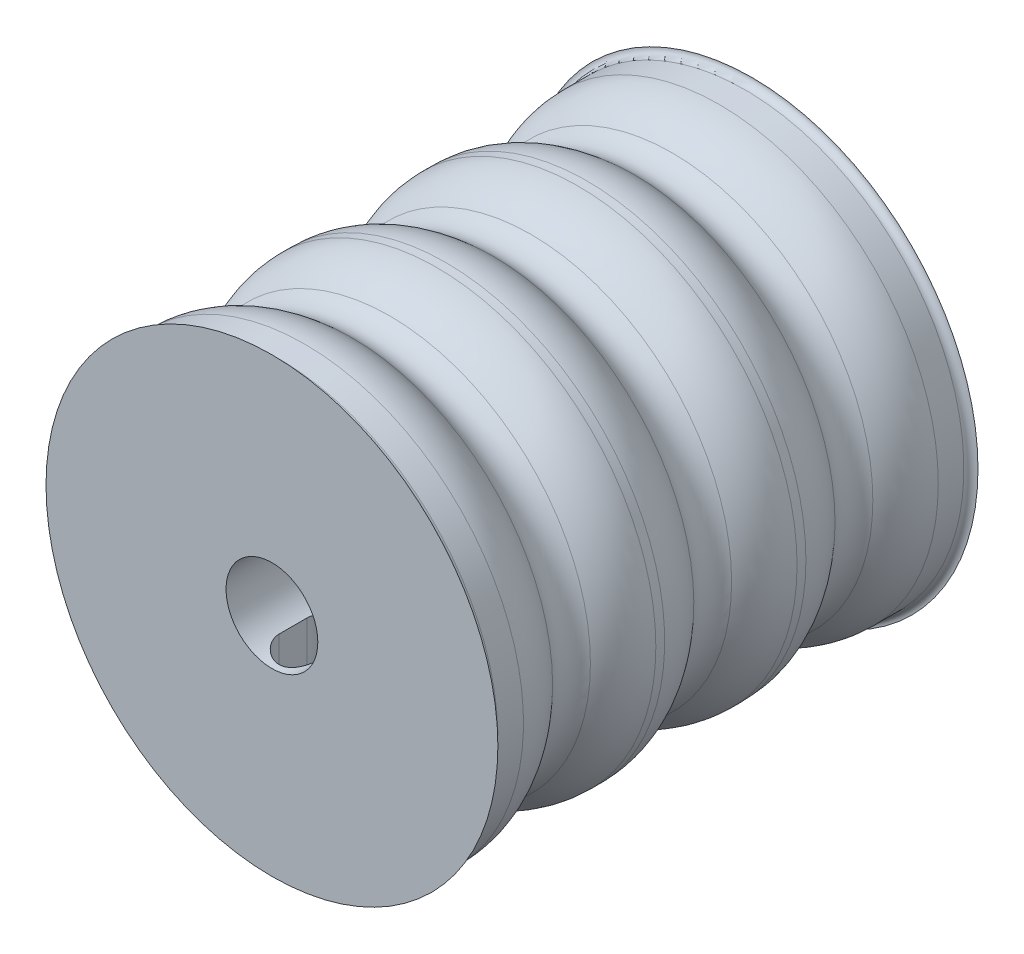
from build123d import *
from build123d.topology import SkipClean

# Parameters (mm, degrees)
ESQUISSE1_R              = 16.5
ESQUISSE1_R_2            = 3.25
BOSS_EXTRU_1_DEPTH       = 34
CONG_1_R                 = 5
ENL_V_MAT_EXTRU_13_DEPTH = 41.841155797


with BuildPart() as part:
    # Esquisse1 → Boss.-Extru.1 (new body)
    with BuildSketch(Plane.XY):
        Circle(ESQUISSE1_R)
        Circle(ESQUISSE1_R_2, mode=Mode.SUBTRACT)
    extrude(amount=BOSS_EXTRU_1_DEPTH)

    # Esquisse13 → Enlèvement de matière-Révolution1 (revolve, cut)
    with BuildSketch(Plane(origin=(0, 0, 0), x_dir=(1, 0, 0), z_dir=(0, 1, 0))):
        with BuildLine():
            Line((-16.5, -34), (-16, -34))
            ThreePointArc((-16, -34), (-15.646446609, -33.853553391), (-15.5, -33.5))
            Line((-15.5, -33.5), (-15.5, -28.989974874))
            ThreePointArc((-15.5, -28.989974874), (-13.7, -27), (-15.5, -25.010025126))
            Line((-15.5, -25.010025126), (-15.5, -18.989974874))
            ThreePointArc((-15.5, -18.989974874), (-13.7, -17), (-15.5, -15.010025126))
            Line((-15.5, -15.010025126), (-15.5, -8.989974874))
            ThreePointArc((-15.5, -8.989974874), (-13.7, -7), (-15.5, -5.010025126))
            Line((-15.5, -5.010025126), (-15.5, -0.5))
            ThreePointArc((-15.5, -0.5), (-15.646446609, -0.146446609), (-16, 0))
            Line((-16, 0), (-16.5, 0))
            Line((-16.5, 0), (-16.5, -34))
        make_face()
    revolve(axis=Axis((0, 0, 0), (0, 0, 1)), mode=Mode.SUBTRACT)

    # Congé1
    cong_1_edges = [part.edges().sort_by_distance(p)[0] for p in [
        (15.5, 0, 5.010025126),
        (15.5, 0, 8.989974874),
        (15.5, 0, 15.010025126),
        (15.5, 0, 28.989974874),
        (15.5, 0, 25.010025126),
        (15.5, 0, 18.989974874),
    ]]
    fillet(cong_1_edges, radius=CONG_1_R)

    # Esquisse15 → Enlèv. mat.-Extru.13 (cut, through all)
    with SkipClean():  # the faces are left unmerged after this step: merging them gives an invalid solid
        with BuildSketch(Plane(origin=(0, 0, 0), x_dir=(1, 0, 0), z_dir=(0, 1, 0))):
            with BuildLine():
                Line((1.5, -20), (1.5, -24))
                ThreePointArc((1.5, -24), (0, -25.5), (-1.5, -24))
                Line((-1.5, -24), (-1.5, -20))
                ThreePointArc((-1.5, -20), (0, -18.5), (1.5, -20))
            make_face()
            with BuildLine():
                Line((1.5, -30), (1.5, -32))
                ThreePointArc((1.5, -32), (0, -33.5), (-1.5, -32))
                Line((-1.5, -32), (-1.5, -30))
                ThreePointArc((-1.5, -30), (0, -28.5), (1.5, -30))
            make_face()
        extrude(amount=-ENL_V_MAT_EXTRU_13_DEPTH, mode=Mode.SUBTRACT)


solid = part.part
